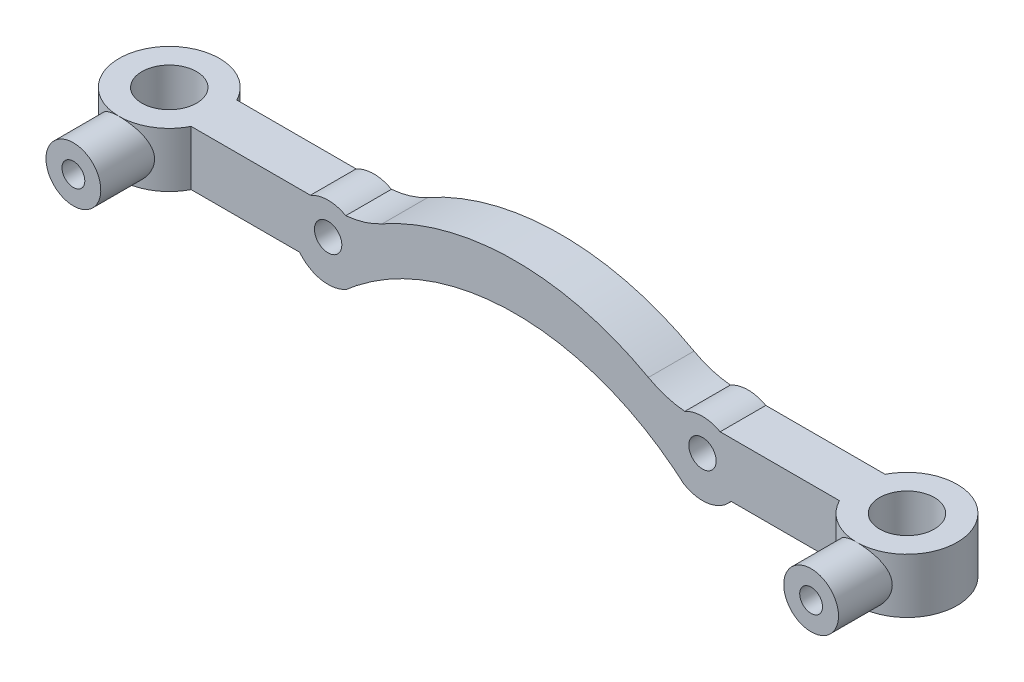
from build123d import *

# Parameters (mm, degrees)
SKETCH1_W                       = 71
SKETCH1_H                       = 6
BOSS_EXTRUDE1_DEPTH             = 5
SKETCH2_R                       = 1.5
CUT_EXTRUDE1_DEPTH              = 36.975686234
SKETCH3_R                       = 4
SKETCH3_R_2                     = 1.5
BOSS_EXTRUDE2_DEPTH             = 5
BOSS_EXTRUDE4_DEPTH             = 5
SKETCH5_R                       = 28
CUT_EXTRUDE3_DEPTH              = 5
FILLET1_R                       = 10
BOSS_EXTRUDE5_REACH             = 38.732
SKETCH6_R                       = 5.5
SKETCH6_R_2                     = 3
BOSS_EXTRUDE5_DIRECTION_2_REACH = 38.732
BOSS_EXTRUDE6_START             = -0.890228
SKETCH7_R                       = 3
SKETCH7_R_2                     = 1.25
BOSS_EXTRUDE6_DEPTH             = 5.890228
CUT_EXTRUDE4_START              = -5
SKETCH8_R                       = 1.25
CUT_EXTRUDE4_DEPTH              = 5
MIRROR7_OUTLINE_W               = 3
MIRROR7_OUTLINE_H               = 5.890504749
CUT_EXTRUDE5_REACH              = 51.262
CUT_EXTRUDE5_END_RADIUS         = 3
SKETCH9_R                       = 1.25


# Read off the part's stored shape, not the designer's step: Mirror7
with BuildPart() as part:
    # Sketch1 → Boss-Extrude1 (new body)
    with BuildSketch(Plane.XY):
        Rectangle(SKETCH1_W, SKETCH1_H)
    extrude(amount=BOSS_EXTRUDE1_DEPTH)

    # Sketch2 → Cut-Extrude1 (cut, through all)
    with BuildSketch(Plane.XY):
        with Locations((20.5, 0)):
            Circle(SKETCH2_R)
        with Locations((-20.5, 0)):
            Circle(SKETCH2_R)
    extrude(amount=CUT_EXTRUDE1_DEPTH, mode=Mode.SUBTRACT)

    # Sketch3 → Boss-Extrude2 (add)
    with BuildSketch(Plane.XY):
        with Locations((20.5, -0.5)):
            Circle(SKETCH3_R)
        with Locations((20.5, 0)):
            Circle(SKETCH3_R_2, mode=Mode.SUBTRACT)
    boss_extrude2 = extrude(amount=BOSS_EXTRUDE2_DEPTH)

    # Mirror1: Boss-Extrude2 across plane
    add(boss_extrude2.mirror(Plane(origin=(0, 0, 0), x_dir=(0, 0, 1), z_dir=(1, 0, 0))))

    # Sketch4 → Boss-Extrude4 (add)
    with BuildSketch(Plane.XY):
        with BuildLine():
            Line((16.583123952, 3), (-16.583123952, 3))
            ThreePointArc((-16.583123952, 3), (0, 8), (16.583123952, 3))
        make_face()
    extrude(amount=BOSS_EXTRUDE4_DEPTH)

    # Sketch5 → Cut-Extrude3 (cut)
    with BuildSketch(Plane.XY):
        with Locations((0, -25)):
            Circle(SKETCH5_R)
    extrude(amount=CUT_EXTRUDE3_DEPTH, mode=Mode.SUBTRACT)

    # Fillet1
    # the kernel refuses this fillet: 10 mm, written as the material it adds along each edge
    with BuildSketch(Plane(origin=(-16.583123952, 3, 0), x_dir=(-1, 0, 0), z_dir=(0, 0, 1))) as fillet1_piece_1:
        with BuildLine():
            CenterArc((2.85012487, -9.962105775), FILLET1_R, 94.989550063, 24.077396017)
            Line((-2.008187335, -1.221579331), (-2.105353579, -1.046768802))
            ThreePointArc((-2.105353579, -1.046768802), (-1.096064984, -0.459595529), (-0.11055416, 0.166666667))
            Line((-0.11055416, 0.166666667), (0, 0.2))
            ThreePointArc((0, 0.2), (0.990192188, 0.2), (1.962989565, 0.199242115))
            Line((1.962989565, 0.199242115), (1.980384375, 0))
        make_face()
    extrude(amount=5)
    with BuildSketch(Plane(origin=(16.583123952, 3, 0), x_dir=(-0.8543488432646742, 0.5196999653764787, 0), z_dir=(0, 0, 1))) as fillet1_piece_2:
        with BuildLine():
            CenterArc((2.74230514, -9.992323342), FILLET1_R, 92.245181841, 24.077396017)
            Line((-1.6919391, -1.029205691), (-1.780623985, -0.849943338))
            ThreePointArc((-1.780623985, -0.849943338), (-0.949909543, -0.343733077), (-0.103939993, 0.170869769))
            Line((-0.103939993, 0.170869769), (0.007835158, 0.199846467))
            ThreePointArc((0.007835158, 0.199846467), (1.175273632, 0.176970025), (2.342712105, 0.199846467))
            Line((2.342712105, 0.199846467), (2.350547263, 0))
        make_face()
    extrude(amount=5)

    # Boss-Extrude5: up to this face of the body (flat: up to its plane)
    boss_extrude5_end = Plane(part.part.faces().sort_by_distance((28.968245837, 3, 2.5))[0])
    # Sketch6 → Boss-Extrude5 (add, up to the picked face)
    with BuildSketch(Plane(origin=(0, 0, 0), x_dir=(1, 0, 0), z_dir=(0, 1, 0)), mode=Mode.PRIVATE) as boss_extrude5_sk1:
        with Locations((40.398979486, -2.5)):
            Circle(SKETCH6_R)
        with Locations(Location((40.398979486, -2.5, 0), (0, 0, 90))):
            Circle(SKETCH6_R_2, mode=Mode.SUBTRACT)
    boss_extrude5_tool1 = split(extrude(boss_extrude5_sk1.sketch, amount=BOSS_EXTRUDE5_REACH, mode=Mode.PRIVATE), bisect_by=boss_extrude5_end, keep=Keep.BOTH, mode=Mode.PRIVATE)
    boss_extrude5 = boss_extrude5_tool1.solids().sort_by(Axis((35.054543, 0, 2.5), (0, 1, 0)))[0]
    add(boss_extrude5)

    # Boss-Extrude5 direction 2: up to this face of the body (flat: up to its plane)
    boss_extrude5_direction_2_end = Plane(part.part.faces().sort_by_distance((29.5612495, -3, 2.5))[0])
    # Sketch6 → Boss-Extrude5 direction 2 (add, up to the picked face)
    with BuildSketch(Plane(origin=(0, 0, 0), x_dir=(1, 0, 0), z_dir=(0, 1, 0)), mode=Mode.PRIVATE) as boss_extrude5_direction_2_sk1:
        with Locations((40.398979486, -2.5)):
            Circle(SKETCH6_R)
        with Locations(Location((40.398979486, -2.5, 0), (0, 0, 90))):
            Circle(SKETCH6_R_2, mode=Mode.SUBTRACT)
    boss_extrude5_direction_2_tool1 = split(extrude(boss_extrude5_direction_2_sk1.sketch, amount=-BOSS_EXTRUDE5_DIRECTION_2_REACH, mode=Mode.PRIVATE), bisect_by=boss_extrude5_direction_2_end, keep=Keep.BOTH, mode=Mode.PRIVATE)
    boss_extrude5_direction_2 = boss_extrude5_direction_2_tool1.solids().sort_by(Axis((35.054543, 0, 2.5), (0, -1, 0)))[0]
    add(boss_extrude5_direction_2)

    # Sketch7 → Boss-Extrude6 (add)
    with BuildSketch(Plane.XY.offset(8).offset(BOSS_EXTRUDE6_START)):
        with Locations(Location((40.398979486, 0, 0), (0, 0, 269.999999959))):
            Circle(SKETCH7_R)
        with Locations((40.398979486, 0)):
            Circle(SKETCH7_R_2, mode=Mode.SUBTRACT)
    extrude(amount=BOSS_EXTRUDE6_DEPTH)

    # Sketch8 → Cut-Extrude4 (cut)
    with BuildSketch(Plane.XY.offset(8).offset(CUT_EXTRUDE4_START)):
        with Locations((40.398979486, 0)):
            Circle(SKETCH8_R)
    extrude(amount=CUT_EXTRUDE4_DEPTH, mode=Mode.SUBTRACT)

    # Mirror5: Boss-Extrude5, Boss-Extrude5 direction 2 across plane
    add(boss_extrude5.mirror(Plane(origin=(0, 0, 0), x_dir=(0, 0, 1), z_dir=(1, 0, 0))))
    add(boss_extrude5_direction_2.mirror(Plane(origin=(0, 0, 0), x_dir=(0, 0, 1), z_dir=(1, 0, 0))))

    # Mirror7 outline → Mirror7 (revolve)
    with BuildSketch(Plane(origin=(-40.398979486, 0, 0), x_dir=(1, 0, 0), z_dir=(0, -1, 0))):
        with Locations((1.5, 10.054747625)):
            Rectangle(MIRROR7_OUTLINE_W, MIRROR7_OUTLINE_H)
    revolve(axis=Axis((-40.398979486, 0, 0), (0, 0, 1)))

    # Cut-Extrude5: up to this cylinder (the profile starts outside it)
    cut_extrude5_end = Plane(origin=(-40.398979486, 0, 2.5), z_dir=(0, -1, 0)) * Cylinder(CUT_EXTRUDE5_END_RADIUS, 109.524, mode=Mode.PRIVATE)
    # Sketch9 → Cut-Extrude5 (cut, up to the surface)
    with BuildSketch(Plane.XY.offset(13), mode=Mode.PRIVATE) as cut_extrude5_sk1:
        with Locations((-40.398979486, 0)):
            Circle(SKETCH9_R)
    cut_extrude5_tool1 = extrude(cut_extrude5_sk1.sketch, amount=-CUT_EXTRUDE5_REACH, mode=Mode.PRIVATE) - cut_extrude5_end
    add(cut_extrude5_tool1.solids().sort_by_distance((-40.398979, 0, 13))[0], mode=Mode.SUBTRACT)


solid = part.part
